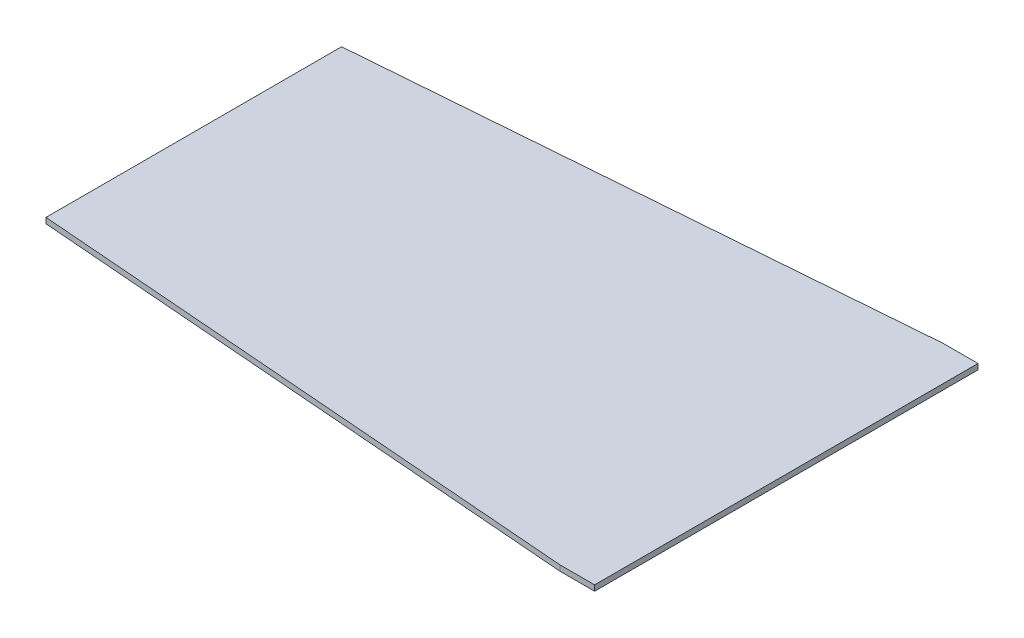
from build123d import *

# Parameters (mm, degrees)
BASE_FLANGE1_DEPTH = 0.508


# Sheet-metal steps are written as plain solids
with BuildPart() as part:
    # Sketch1 → Base-Flange1 (new body)
    with BuildSketch(Plane(origin=(0, 0, 0), x_dir=(1, 0, 0), z_dir=(0, 1, 0))):
        Polygon((0, -17.4625), (0, 17.4625), (-3.175, 17.4625), (-53.975, 13.462), (-53.975, -13.462), (-3.175, -17.4625), align=None)
    extrude(amount=-BASE_FLANGE1_DEPTH)


solid = part.part
